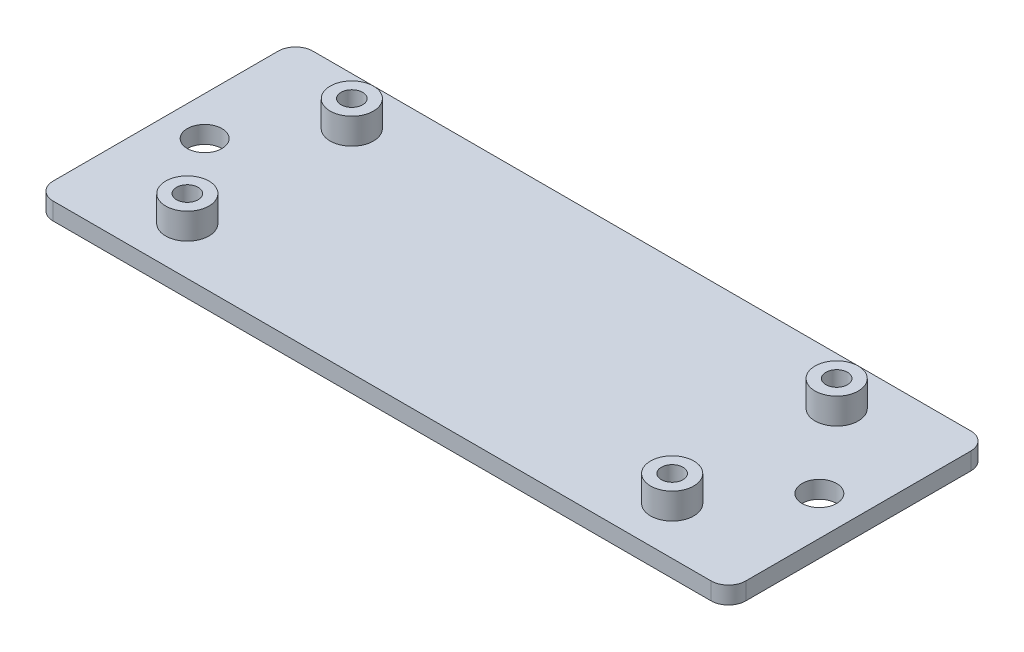
from build123d import *

# Parameters (mm, degrees)
SKETCH_1_W               = 80
SKETCH_1_H               = 30
EXTRUDE_1_DEPTH          = 2
SKETCH_2_R               = 2.5
EXTRUDE_2_DEPTH          = 3
CUT_EXTRUDE_1_DEPTH      = 86.586213843
CUT_EXTRUDE_1_DEPTH_BACK = 86.586213843
SKETCH_3_R               = 1.25
CUT_EXTRUDE_2_DEPTH      = 86.492689746
CUT_EXTRUDE_2_DEPTH_BACK = 86.492689746
SKETCH_4_R               = 2
FILLET_1_R               = 2
FILLET_2_R               = 2
FILLET_3_R               = 2
FILLET_4_R               = 2


with BuildPart() as part:
    # Эскиз1 → Бобышка-Вытянуть1 (new body)
    with BuildSketch(Plane(origin=(0, 0, 0), x_dir=(1, 0, 0), z_dir=(0, 1, 0))):
        with Locations((40, -15)):
            Rectangle(SKETCH_1_W, SKETCH_1_H)
    extrude(amount=EXTRUDE_1_DEPTH)

    # Эскиз2 → Бобышка-Вытянуть2 (add)
    with BuildSketch(Plane(origin=(0, 2, 0), x_dir=(1, 0, 0), z_dir=(0, 1, 0))):
        with Locations((12, -5.5)):
            Circle(SKETCH_2_R)
        with Locations((12, -24.5)):
            Circle(SKETCH_2_R)
        with Locations((68, -5.5)):
            Circle(SKETCH_2_R)
        with Locations((68, -24.5)):
            Circle(SKETCH_2_R)
    extrude(amount=EXTRUDE_2_DEPTH)

    # Эскиз3 → Вырез-Вытянуть1 (cut, two sides: drawn at the far end of the back side and taken through both)
    with BuildSketch(Plane(origin=(0, 5, 0), x_dir=(1, 0, 0), z_dir=(0, 1, 0)).offset(-CUT_EXTRUDE_1_DEPTH_BACK)):
        with Locations((12, -5.5)):
            Circle(SKETCH_3_R)
        with Locations((12, -24.5)):
            Circle(SKETCH_3_R)
        with Locations((68, -5.5)):
            Circle(SKETCH_3_R)
        with Locations((68, -24.5)):
            Circle(SKETCH_3_R)
    extrude(amount=CUT_EXTRUDE_1_DEPTH + CUT_EXTRUDE_1_DEPTH_BACK, mode=Mode.SUBTRACT)

    # Эскиз4 → Вырез-Вытянуть2 (cut, two sides: drawn at the far end of the back side and taken through both)
    with BuildSketch(Plane(origin=(0, 2, 0), x_dir=(1, 0, 0), z_dir=(0, 1, 0)).offset(-CUT_EXTRUDE_2_DEPTH_BACK)):
        with Locations((4.5, -15)):
            Circle(SKETCH_4_R)
        with Locations((75.5, -15)):
            Circle(SKETCH_4_R)
    extrude(amount=CUT_EXTRUDE_2_DEPTH + CUT_EXTRUDE_2_DEPTH_BACK, mode=Mode.SUBTRACT)

    # Скругление1
    fillet_1_edges = [part.edges().sort_by_distance(p)[0] for p in [
        (0, 1, 30),
    ]]
    fillet(fillet_1_edges, radius=FILLET_1_R)

    # Скругление2
    fillet_2_edges = [part.edges().sort_by_distance(p)[0] for p in [
        (0, 1, 0),
    ]]
    fillet(fillet_2_edges, radius=FILLET_2_R)

    # Скругление3
    fillet_3_edges = [part.edges().sort_by_distance(p)[0] for p in [
        (80, 1, 0),
    ]]
    fillet(fillet_3_edges, radius=FILLET_3_R)

    # Скругление4
    fillet_4_edges = [part.edges().sort_by_distance(p)[0] for p in [
        (80, 1, 30),
    ]]
    fillet(fillet_4_edges, radius=FILLET_4_R)


solid = part.part
